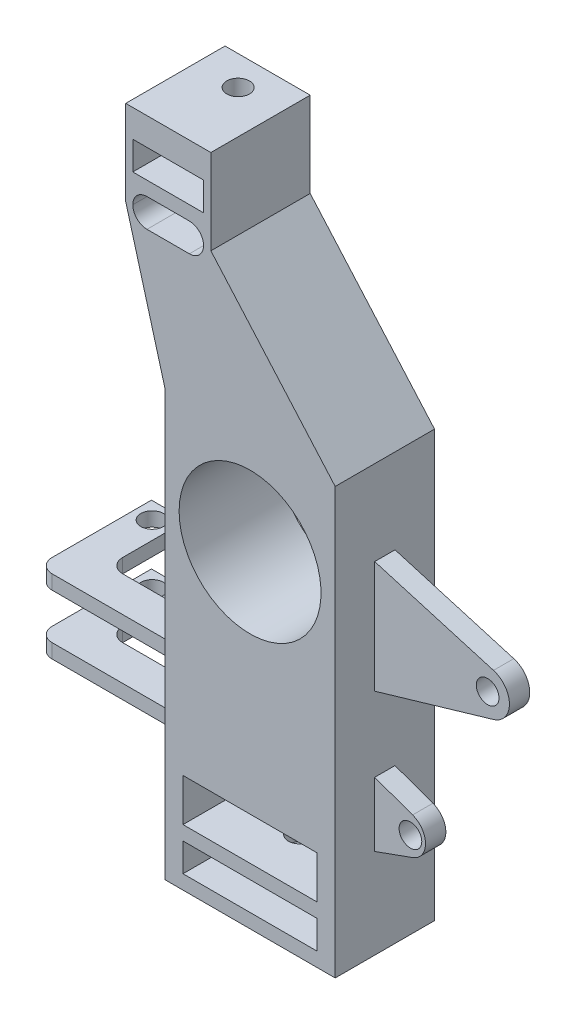
from build123d import *

# Parameters (mm, degrees)
BOSS_EXTRUDE1_DEPTH = 17.5
SKETCH6_W           = 24.942027916
SKETCH6_H           = 10
SKETCH6_W_2         = 47.258134024
SKETCH6_H_2         = 15
CUT_EXTRUDE1_DEPTH  = 228.033901494
SKETCH7_R           = 25
CUT_EXTRUDE2_DEPTH  = 228.033901494
SKETCH8_R           = 4
CUT_EXTRUDE3_DEPTH  = 30
SKETCH10_R          = 4
CUT_EXTRUDE4_DEPTH  = 30
SKETCH11_W          = 7.160304618
SKETCH11_H          = 39.552070702
SKETCH11_H_2        = 22.637315958
BOSS_EXTRUDE2_DEPTH = 50
SKETCH13_R          = 4
CUT_EXTRUDE5_DEPTH  = 50
CUT_EXTRUDE6_DEPTH  = 50
CUT_EXTRUDE7_DEPTH  = 50
BOSS_EXTRUDE3_DEPTH = 70
SKETCH19_R          = 4
CUT_EXTRUDE8_DEPTH  = 70
SKETCH20_W          = 48.774167315
SKETCH20_H          = 27.556784468
CUT_EXTRUDE9_DEPTH  = 70
CUT_EXTRUDE10_DEPTH = 70
FILLET1_R           = 5
FILLET2_R           = 5
FILLET3_R           = 5
FILLET4_R           = 5


with BuildPart() as part:
    # Sketch1 → Boss-Extrude1 (new, symmetric)
    with BuildSketch(Plane.XY):
        Polygon((30, -10), (-30, -10), (-30, 140), (-43.810871114, 190), (-43.810871114, 220), (-13.810871114, 220), (-13.810871114, 190), (30, 140), align=None)
    extrude(amount=BOSS_EXTRUDE1_DEPTH, both=True)

    # Sketch6 → Cut-Extrude1 (cut, through all)
    with BuildSketch(Plane(origin=(0, 0, -17.5), x_dir=(-1, 0, 0), z_dir=(0, 0, -1))):
        with Locations((28.85405418, 190.307263481)):
            Rectangle(SKETCH6_W, SKETCH6_H)
        Rectangle(SKETCH6_W_2, SKETCH6_H)
        with Locations((0, 17.5)):
            Rectangle(SKETCH6_W_2, SKETCH6_H_2)
        with Locations((28.85405418, 205.307263481)):
            Rectangle(SKETCH6_W, SKETCH6_H)
    extrude(amount=-CUT_EXTRUDE1_DEPTH, mode=Mode.SUBTRACT)

    # Sketch7 → Cut-Extrude2 (cut, through all)
    with BuildSketch(Plane(origin=(0, 0, -17.5), x_dir=(-1, 0, 0), z_dir=(0, 0, -1))):
        with Locations((0, 105)):
            Circle(SKETCH7_R)
    extrude(amount=-CUT_EXTRUDE2_DEPTH, mode=Mode.SUBTRACT)

    # Sketch8 → Cut-Extrude3 (cut)
    with BuildSketch(Plane(origin=(0, 220, 0), x_dir=(1, 0, 0), z_dir=(0, 1, 0))):
        with Locations(Location((-28.860081831, 7.158757746, 0), (0, 0, 270))):
            Circle(SKETCH8_R)
    extrude(amount=-CUT_EXTRUDE3_DEPTH, mode=Mode.SUBTRACT)

    # Sketch10 → Cut-Extrude4 (cut)
    with BuildSketch(Plane.XZ.offset(10)):
        Circle(SKETCH10_R)
    extrude(amount=-CUT_EXTRUDE4_DEPTH, mode=Mode.SUBTRACT)

    # Sketch11 → Boss-Extrude2 (add)
    with BuildSketch(Plane(origin=(30, 0, 0), x_dir=(0, 0, -1), z_dir=(1, 0, 0))):
        with Locations((-0.000773436, 90.343921661)):
            Rectangle(SKETCH11_W, SKETCH11_H)
        with Locations((-0.000773436, 32.969473472)):
            Rectangle(SKETCH11_W, SKETCH11_H_2)
    extrude(amount=BOSS_EXTRUDE2_DEPTH)

    # Sketch13 → Cut-Extrude5 (cut)
    with BuildSketch(Plane.XY.offset(3.580925745)):
        with Locations((69.802457577, 90.343921661)):
            Circle(SKETCH13_R)
        with Locations((42.591748381, 32.969473472)):
            Circle(SKETCH13_R)
    extrude(amount=-CUT_EXTRUDE5_DEPTH, mode=Mode.SUBTRACT)

    # Sketch14 → Cut-Extrude6 (cut)
    with BuildSketch(Plane.XY.offset(3.580925745)):
        with BuildLine():
            Line((30, 110.119957012), (71.857382865, 97.843921661))
            ThreePointArc((71.857382865, 97.843921661), (77.47366635, 90.343921661), (71.857382865, 82.843921661))
            Line((71.857382865, 82.843921661), (30, 70.56788631))
            Line((30, 70.56788631), (80, 70.56788631))
            Line((80, 70.56788631), (80, 110.119957012))
            Line((80, 110.119957012), (30, 110.119957012))
        make_face()
    extrude(amount=-CUT_EXTRUDE6_DEPTH, mode=Mode.SUBTRACT)

    # Sketch15 → Cut-Extrude7 (cut)
    with BuildSketch(Plane.XY.offset(3.580925745)):
        with BuildLine():
            Line((30, 44.288131451), (43.349487429, 39.469473472))
            ThreePointArc((43.349487429, 39.469473472), (47.913726584, 32.969473472), (43.349487429, 26.469473472))
            Line((43.349487429, 26.469473472), (30, 21.650815493))
            Line((30, 21.650815493), (80, 21.650815493))
            Line((80, 21.650815493), (80, 44.288131451))
            Line((80, 44.288131451), (30, 44.288131451))
        make_face()
    extrude(amount=-CUT_EXTRUDE7_DEPTH, mode=Mode.SUBTRACT)

    # Sketch18 → Boss-Extrude3 (add)
    with BuildSketch(Plane.ZY.offset(30)):
        Polygon((11.672732765, 47), (-11.672732765, 47), (-38.952313989, 47), (-38.952313989, 42), (-11.672732765, 42), (11.672732765, 42), align=None)
        Polygon((-11.672732765, 26), (-38.952313989, 26), (-38.952313989, 21), (-11.672732765, 21), (11.672732765, 21), (11.672732765, 26), align=None)
    extrude(amount=BOSS_EXTRUDE3_DEPTH)

    # Sketch19 → Cut-Extrude8 (cut)
    with BuildSketch(Plane(origin=(0, 47, 0), x_dir=(1, 0, 0), z_dir=(0, 1, 0))):
        with Locations(Location((-85, 33, 0), (0, 0, 270))):
            Circle(SKETCH19_R)
    extrude(amount=-CUT_EXTRUDE8_DEPTH, mode=Mode.SUBTRACT)

    # Sketch20 → Cut-Extrude9 (cut)
    with BuildSketch(Plane.XZ.offset(-21)):
        with Locations((-54.387083657, -25.173921755)):
            Rectangle(SKETCH20_W, SKETCH20_H)
    extrude(amount=-CUT_EXTRUDE9_DEPTH, mode=Mode.SUBTRACT)

    # Sketch22 → Cut-Extrude10 (cut)
    with BuildSketch(Plane.XZ.offset(-21)):
        Polygon((-91.205371371, -38.952313989), (-91.205371371, 1.034470479), (-30, 1.034470479), (-30, 11.672732765), (-100, 11.672732765), (-100, -38.952313989), align=None)
    extrude(amount=-CUT_EXTRUDE10_DEPTH, mode=Mode.SUBTRACT)

    # Fillet1
    fillet1_edges = [part.edges().sort_by_distance(p)[0] for p in [
        (-78.774167315, 44.5, -11.395529521),
    ]]
    fillet(fillet1_edges, radius=FILLET1_R)

    # Fillet2
    fillet2_edges = [part.edges().sort_by_distance(p)[0] for p in [
        (-78.774167315, 23.5, -11.395529521),
    ]]
    fillet(fillet2_edges, radius=FILLET2_R)

    # Fillet3
    fillet3_edges = [part.edges().sort_by_distance(p)[0] for p in [
        (-91.205371371, 44.5, 1.034470479),
        (-91.205371371, 23.5, 1.034470479),
    ]]
    fillet(fillet3_edges, radius=FILLET3_R)

    # Fillet4
    fillet4_edges = [part.edges().sort_by_distance(p)[0] for p in [
        (-41.325068138, 185.307263481, 0),
        (-16.383040222, 185.307263481, 0),
        (-16.383040222, 195.307263481, 0),
        (-41.325068138, 195.307263481, 0),
    ]]
    fillet(fillet4_edges, radius=FILLET4_R - 0.0001)  # a hair under: the kernel refuses the full size


solid = part.part
